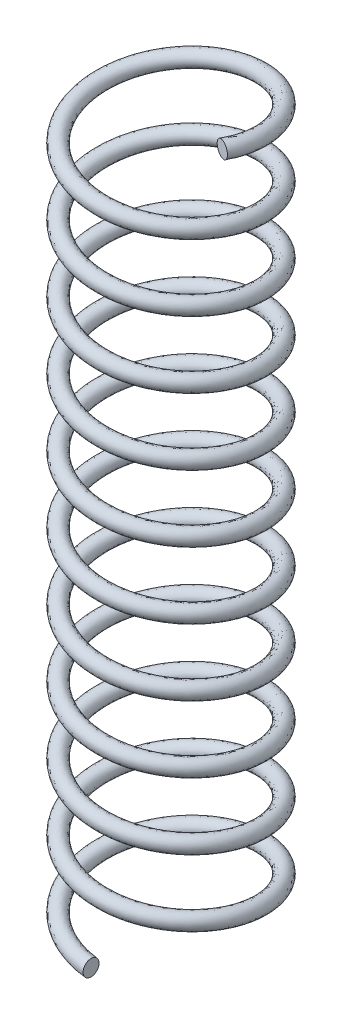
from build123d import *

# Parameters (mm, degrees)
SWEEP_1_PITCH  = 5
SWEEP_1_HEIGHT = 54
SWEEP_1_RADIUS = 6
SKETCH_3_R     = 0.6


with BuildPart() as part:
    # ｽｲｰﾌﾟ1: sweep along a helix
    with BuildLine() as sweep_1_path:
        Helix(SWEEP_1_PITCH, SWEEP_1_HEIGHT, SWEEP_1_RADIUS, center=(0, 0, 0), direction=(0, 1, 0), lefthand=True)
    # ｽｹｯﾁ3 → ｽｲｰﾌﾟ1 (sweep)
    with BuildSketch(Plane(origin=(0, 0, 0), x_dir=(0, 0, -1), z_dir=(1, 0, 0))):
        with Locations((-6, 0)):
            Circle(SKETCH_3_R)
    sweep(path=sweep_1_path.line, is_frenet=True)


solid = part.part
